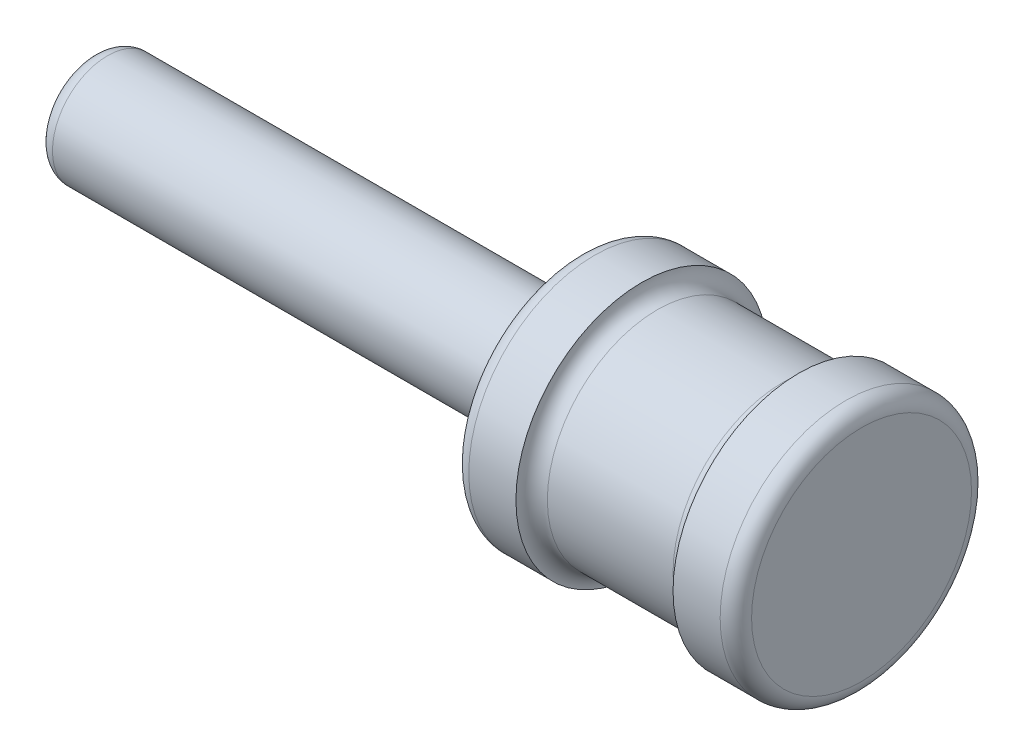
from build123d import *

# Parameters (mm, degrees)
VERRUNDUNG1_R = 0.5


with BuildPart() as part:
    # Skizze1 → Rotation1 (revolve)
    with BuildSketch(Plane.XY):
        Polygon((0, 0), (-24.5, 0), (-24.5, 1.75), (-9, 1.75), (-9, 4), (-7, 4), (-7, 3.5), (-2, 3.5), (-2, 4), (0, 4), align=None)
    revolve(axis=Axis((0, 0, 0), (-1, 0, 0)))

    # Verrundung1
    verrundung1_edges = [part.edges().sort_by_distance(p)[0] for p in [
        (-24.5, -1.75, 0),
        (0, -4, 0),
        (-2, -3.5, 0),
        (-7, -3.5, 0),
        (-9, -4, 0),
    ]]
    fillet(verrundung1_edges, radius=VERRUNDUNG1_R - 0.0001)  # a hair under: the kernel refuses the full size


solid = part.part
